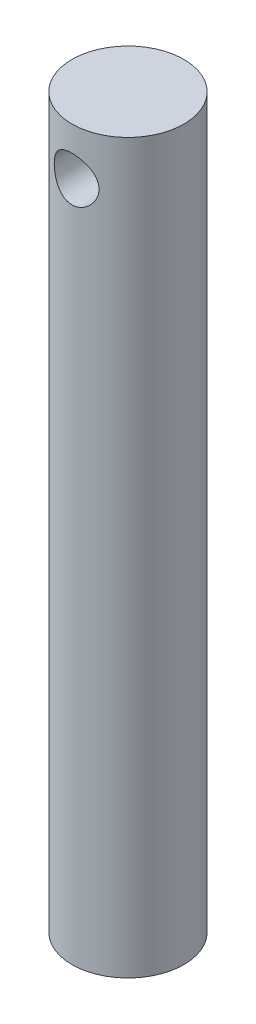
from build123d import *

# Parameters (mm, degrees)
SKETCH_1_R          = 10
EXTRUDE_1_DEPTH     = 130
SKETCH_2_R          = 4
CUT_EXTRUDE_2_DEPTH = 25


with BuildPart() as part:
    # Эскиз1 → Вытянуть1 (new body)
    with BuildSketch(Plane(origin=(0, 0, 0), x_dir=(1, 0, 0), z_dir=(0, 1, 0))):
        Circle(SKETCH_1_R)
    extrude(amount=EXTRUDE_1_DEPTH)

    # Эскиз2 → Вытянуть2 (cut, symmetric)
    with BuildSketch(Plane.XY):
        with Locations((0, 121.5)):
            Circle(SKETCH_2_R)
    extrude(amount=CUT_EXTRUDE_2_DEPTH, both=True, mode=Mode.SUBTRACT)


solid = part.part
